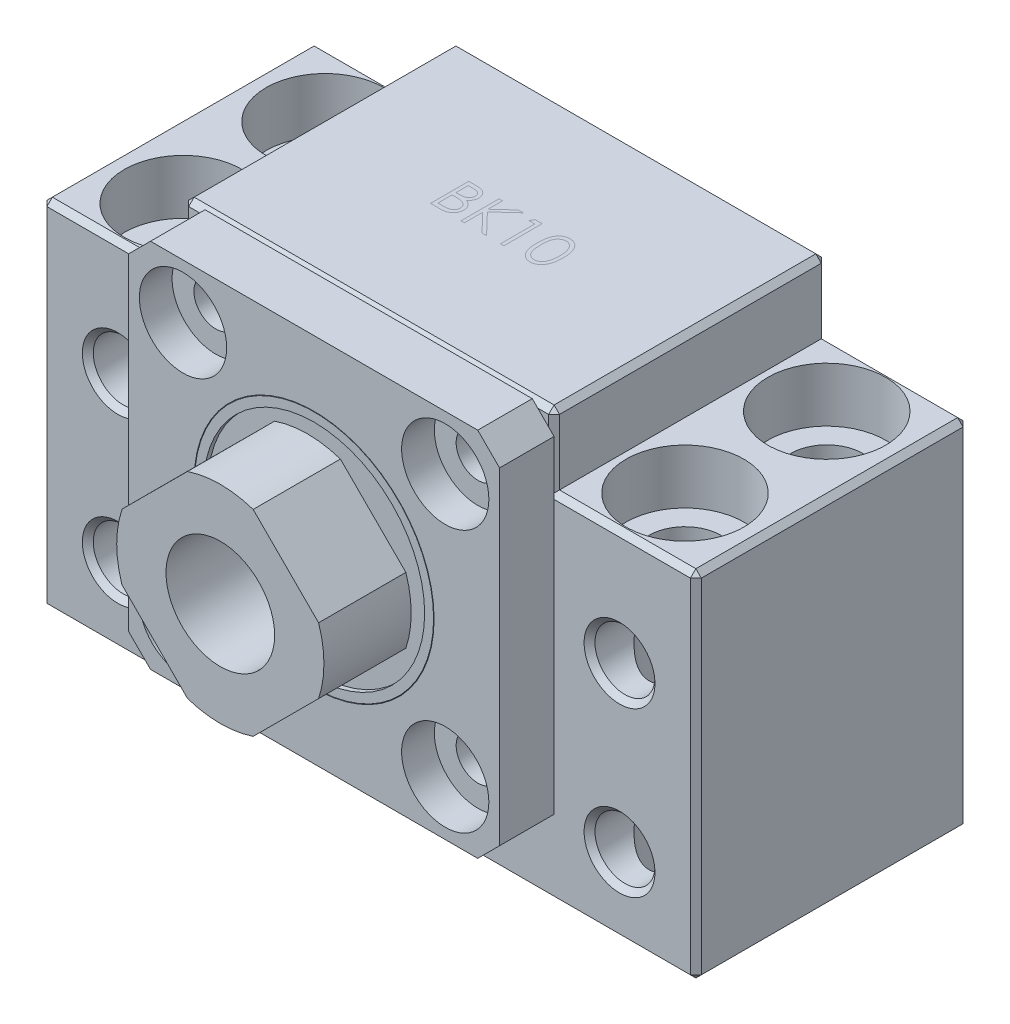
from build123d import *

# Parameters (mm, degrees)
SKETCH1_R           = 2.75
BOSS_EXTRUDE1_DEPTH = 25
HOLE1_D             = 21
HOLE1_CBORE_D       = 26
HOLE1_CBORE_DEPTH   = 20
SKETCH10_R          = 3.3
CUT_EXTRUDE3_DEPTH  = 47.703854231
SKETCH11_R          = 5.4
CUT_EXTRUDE4_DEPTH  = 5
CHAMFER3_SIZE       = 0.5
SKETCH14_R          = 2
SKETCH14_R_2        = 11
BOSS_EXTRUDE2_DEPTH = 5
SKETCH15_R          = 4
CUT_EXTRUDE5_DEPTH  = 3
SKETCH16_W          = 1.045765198
SKETCH16_H          = 1.925305348
SKETCH17_R          = 11
CUT_EXTRUDE6_DEPTH  = 8


with BuildPart() as part:
    # Sketch1 → Boss-Extrude1 (new body)
    with BuildSketch(Plane(origin=(0, 0, -10), x_dir=(-1, 0, 0), z_dir=(0, 0, -1))):
        Polygon((-30, 0), (30, 0), (30, 32.5), (17, 32.5), (17, 39), (-17, 39), (-17, 32.5), (-30, 32.5), align=None)
        with Locations((-23, 22)):
            Circle(SKETCH1_R, mode=Mode.SUBTRACT)
        with Locations((23, 22)):
            Circle(SKETCH1_R, mode=Mode.SUBTRACT)
        with Locations((23, 7)):
            Circle(SKETCH1_R, mode=Mode.SUBTRACT)
        with Locations((-23, 7)):
            Circle(SKETCH1_R, mode=Mode.SUBTRACT)
    extrude(amount=-BOSS_EXTRUDE1_DEPTH)

    # Hole1 (through all)
    with Locations(Plane(origin=(0, 0, 15), x_dir=(-1, 0, 0), z_dir=(0, 0, 1))):
        with Locations((0, -22)):
            CounterBoreHole(HOLE1_D / 2, HOLE1_CBORE_D / 2, HOLE1_CBORE_DEPTH)

    # Sketch10 → Cut-Extrude3 (cut, through all)
    with BuildSketch(Plane(origin=(0, 32.5, 0), x_dir=(1, 0, 0), z_dir=(0, 1, 0))):
        with Locations((-23, 4)):
            Circle(SKETCH10_R)
        with Locations((23, 4)):
            Circle(SKETCH10_R)
        with Locations((-23, -9)):
            Circle(SKETCH10_R)
        with Locations((23, -9)):
            Circle(SKETCH10_R)
    extrude(amount=-CUT_EXTRUDE3_DEPTH, mode=Mode.SUBTRACT)

    # Sketch11 → Cut-Extrude4 (cut)
    with BuildSketch(Plane(origin=(0, 32.5, 0), x_dir=(1, 0, 0), z_dir=(0, 1, 0))):
        with Locations((-23, 4)):
            Circle(SKETCH11_R)
        with Locations((23, 4)):
            Circle(SKETCH11_R)
        with Locations((-23, -9)):
            Circle(SKETCH11_R)
        with Locations((23, -9)):
            Circle(SKETCH11_R)
    extrude(amount=-CUT_EXTRUDE4_DEPTH, mode=Mode.SUBTRACT)

    # Chamfer3
    chamfer3_edges = [part.edges().sort_by_distance(p)[0] for p in [
        (0, 0, -10),
        (30, 16.25, -10),
        (23.5, 32.5, -10),
        (17, 35.75, -10),
        (0, 39, -10),
        (-17, 35.75, -10),
        (-23.5, 32.5, -10),
        (-30, 16.25, -10),
        (25.75, 22, -10),
        (-20.25, 22, -10),
        (-20.25, 7, -10),
        (25.75, 7, -10),
        (-23.5, 32.5, 15),
        (-17, 35.75, 15),
        (0, 39, 15),
        (17, 35.75, 15),
        (23.5, 32.5, 15),
        (30, 16.25, 15),
        (0, 0, 15),
        (-30, 16.25, 15),
        (25.75, 22, 15),
        (-20.25, 22, 15),
        (-20.25, 7, 15),
        (25.75, 7, 15),
        (-30, 32.5, 2.5),
        (-30, 0, 2.5),
        (30, 0, 2.5),
        (30, 32.5, 2.5),
        (17, 39, 2.5),
        (-17, 39, 2.5),
        (13, 22, 15),
        (-10.5, 22, -10),
    ]]
    chamfer(chamfer3_edges, length=CHAMFER3_SIZE)


with BuildPart() as body_2:
    # Sketch14 → Boss-Extrude2 (new body)
    with BuildSketch(Plane.XY.offset(15)):
        Polygon((-15, 39), (-17, 37), (-17, 7), (-15, 5), (15, 5), (17, 7), (17, 37), (15, 39), align=None)
        with Locations((-12.02081528, 9.97918472)):
            Circle(SKETCH14_R, mode=Mode.SUBTRACT)
        with Locations((12.02081528, 9.97918472)):
            Circle(SKETCH14_R, mode=Mode.SUBTRACT)
        with Locations((12.02081528, 34.02081528)):
            Circle(SKETCH14_R, mode=Mode.SUBTRACT)
        with Locations((-12.02081528, 34.02081528)):
            Circle(SKETCH14_R, mode=Mode.SUBTRACT)
        with Locations((0, 22)):
            Circle(SKETCH14_R_2, mode=Mode.SUBTRACT)
    extrude(amount=BOSS_EXTRUDE2_DEPTH)

    # Sketch15 → Cut-Extrude5 (cut)
    with BuildSketch(Plane.XY.offset(20)):
        with Locations((-12.02081528, 34.02081528)):
            Circle(SKETCH15_R)
        with Locations((12.02081528, 34.02081528)):
            Circle(SKETCH15_R)
        with Locations((-12.02081528, 9.97918472)):
            Circle(SKETCH15_R)
        with Locations((12.02081528, 9.97918472)):
            Circle(SKETCH15_R)
    extrude(amount=-CUT_EXTRUDE5_DEPTH, mode=Mode.SUBTRACT)


with BuildPart() as body_3:
    # Sketch16 → Revolve1 (revolve)
    # profile 1 of 3: a face of its own
    with BuildSketch(Plane(origin=(0, 0, 0), x_dir=(0, 0, -1), z_dir=(1, 0, 0))):
        Polygon((-20.6, 15), (-19.572933314, 15), (-19.572933314, 11.86713784), (-20, 11.86713784), (-20, 11.046430571), (-19.786466657, 10.930367031), (-16.712901969, 10.930367031), (-16.712901969, 16.623661086), (-20.6, 16.623661086), (-20.6, 17.02), (-28.6, 17.02), (-28.6, 12.5), (-20.6, 12.5), align=None)
    # profile 2 of 3: a face of its own
    with BuildSketch(Plane(origin=(0, 0, 0), x_dir=(0, 0, -1), z_dir=(1, 0, 0))):
        Polygon((10.4, 17), (-11, 17), (-11, 8.878511973), (5, 8.878511973), (5, 11.453589915), (9.505179317, 11.453589915), (9.505179317, 13.054694652), (8.345150213, 13.054694652), (8.345150213, 14.996012529), (10.4, 14.996012529), align=None)
        with Locations((5.522882599, 14.037347326)):
            Rectangle(SKETCH16_W, SKETCH16_H, mode=Mode.SUBTRACT)
    # profile 3 of 3: a face of its own
    with BuildSketch(Plane(origin=(0, 0, 0), x_dir=(0, 0, -1), z_dir=(1, 0, 0))):
        Polygon((-16.6, 17.02), (-16.6, 15.016012529), (-14.445150213, 15.016012529), (-14.445150213, 13.074694652), (-15.537963996, 13.074694652), (-15.537963996, 10.930367031), (-11.126638066, 10.930367031), (-11.126638066, 13.074609177), (-12.254682341, 13.074609177), (-12.254682341, 15.019914524), (-11.13728513, 15.019914524), (-11.13728513, 17.02), align=None)
    revolve(axis=Axis((0, 22, 15), (0, 0, -1)))

    # Sketch17 → Cut-Extrude6 (cut)
    with BuildSketch(Plane.XY.offset(28.6)):
        with Locations((0, 22)):
            Circle(SKETCH17_R)
        Polygon((-1.98535533, 32.036985127), (-10.067344949, 23.971992313), (-10.112729298, 20.110569523), (-2.003809658, 11.984560504), (2.005374965, 11.984560504), (10.058082772, 20.03726831), (10.058082772, 23.96273169), (1.983829335, 32.036985127), align=None, mode=Mode.SUBTRACT)
    extrude(amount=-CUT_EXTRUDE6_DEPTH, mode=Mode.SUBTRACT)


solid = Compound([part.part, body_2.part, body_3.part])
